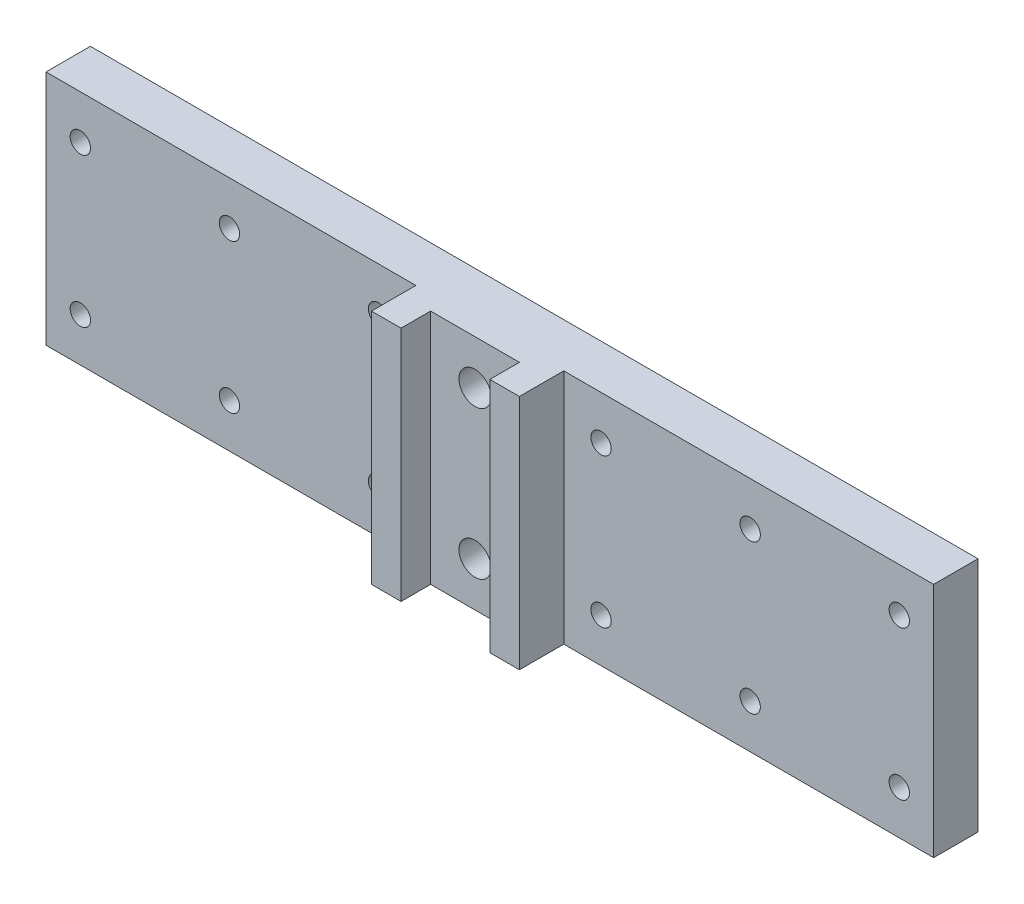
from build123d import *

# Parameters (mm, degrees)
SKETCH1_W                       = 95.25
SKETCH1_H                       = 25.4
BOSS_EXTRUDE1_DEPTH             = 9.525
SKETCH2_W                       = 9.525
SKETCH2_H                       = 3.175
SKETCH2_W_2                     = 39.6875
SKETCH2_H_2                     = 4.7625
CUT_EXTRUDE1_DEPTH              = 100.037609649
F_8_32_TAPPED_HOLE1_D           = 3.4544
F_44_0_086_DIAMETER_HOLE1_D     = 2.1844
F_44_0_086_DIAMETER_HOLE1_DEPTH = 9.652
F_44_0_086_DIAMETER_HOLE1_TIP   = 0.656259968


with BuildPart() as part:
    # Sketch1 → Boss-Extrude1 (new body)
    with BuildSketch(Plane.XY):
        with Locations((47.625, 12.7)):
            Rectangle(SKETCH1_W, SKETCH1_H)
    extrude(amount=BOSS_EXTRUDE1_DEPTH)

    # Sketch2 → Cut-Extrude1 (cut, through all)
    with BuildSketch(Plane(origin=(0, 25.4, 0), x_dir=(1, 0, 0), z_dir=(0, 1, 0))):
        with Locations((47.625, -7.9375)):
            Rectangle(SKETCH2_W, SKETCH2_H)
        with Locations((19.84375, -7.14375)):
            Rectangle(SKETCH2_W_2, SKETCH2_H_2)
        with Locations((75.40625, -7.14375)):
            Rectangle(SKETCH2_W_2, SKETCH2_H_2)
    extrude(amount=-CUT_EXTRUDE1_DEPTH, mode=Mode.SUBTRACT)

    # #8-32 Tapped Hole1 (through all)
    with Locations(Plane.XY.offset(6.35)):
        with Locations((47.625, 4.7625), (47.625, 20.6375)):
            Hole(F_8_32_TAPPED_HOLE1_D / 2)

    # #44 (0.086) Diameter Hole1
    with Locations(Plane(origin=(0, 0, 0), x_dir=(-1, 0, 0), z_dir=(0, 0, -1))):
        with Locations((-35.685, 20.7), (-3.685, 20.7), (-19.685, 20.7), (-35.685, 4.7), (-3.685, 4.7), (-59.565, 4.7), (-91.565, 4.7), (-59.565, 20.7), (-91.565, 20.7), (-75.565, 20.7), (-75.565, 4.7), (-19.685, 4.7)):
            Hole(F_44_0_086_DIAMETER_HOLE1_D / 2, depth=F_44_0_086_DIAMETER_HOLE1_DEPTH)
            with Locations((0, 0, -(F_44_0_086_DIAMETER_HOLE1_DEPTH + F_44_0_086_DIAMETER_HOLE1_TIP / 2))):  # 118° drill point
                Cone(0, F_44_0_086_DIAMETER_HOLE1_D / 2, F_44_0_086_DIAMETER_HOLE1_TIP, mode=Mode.SUBTRACT)


solid = part.part
